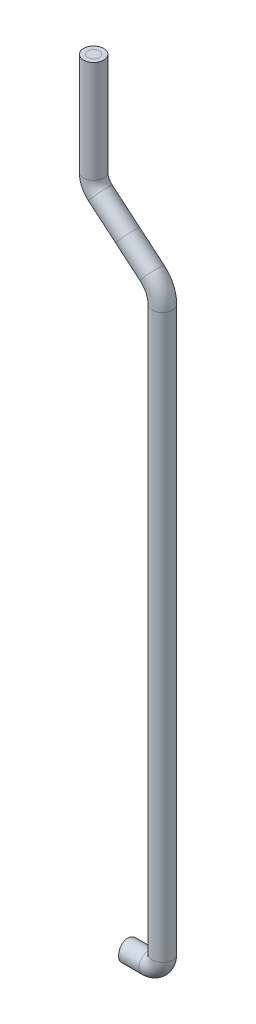
from build123d import *

# Parameters (mm, degrees)
SKETCH_1_R          = 1.05
SKETCH_3_R          = 0.6
SKETCH_4_R          = 0.6
SKETCH_5_R          = 0.6
SKETCH_7_R          = 1.05
SKETCH_7_R_2        = 0.6
CUT_EXTRUDE_2_DEPTH = 3
CUT_EXTRUDE_3_DEPTH = 3


with BuildPart() as part:
    # Sweep 1: sweep along a path in Эскиз2
    with BuildLine(Plane.XY) as sweep_1_path:
        Line((0, 0), (0, 58.480318356))
        ThreePointArc((0, 58.480318356), (-0.281076639, 59.748173141), (-1.071637171, 60.778451685))
        Line((-1.071637171, 60.778451685), (-3.6, 62.900000002))
        Line((-3.6, 62.900000002), (-6.435575219, 65.279330123))
        ThreePointArc((-6.435575219, 65.279330123), (-6.962615574, 65.966182486), (-7.15, 66.811419009))
        Line((-7.15, 66.811419009), (-7.15, 77.419549689))
    # Эскиз1 → Sweep 1 (sweep)
    with BuildSketch(Plane(origin=(0, 0, 0), x_dir=(1, 0, 0), z_dir=(0, 1, 0))):
        Circle(SKETCH_1_R)
    sweep(path=sweep_1_path.line)

    # Sweep 1 2: sweep along a path in Эскиз2<2>
    with BuildLine(Plane.XY) as sweep_1_2_path:
        Line((0, 0), (0, 58.480318356))
        ThreePointArc((0, 58.480318356), (-0.281076639, 59.748173141), (-1.071637171, 60.778451685))
        Line((-1.071637171, 60.778451685), (-3.6, 62.900000002))
        Line((-3.6, 62.900000002), (-6.435575219, 65.279330123))
        ThreePointArc((-6.435575219, 65.279330123), (-6.962615574, 65.966182486), (-7.15, 66.811419009))
        Line((-7.15, 66.811419009), (-7.15, 77.419549689))
    # Эскиз3 → Sweep 1 2 (sweep, cut)
    with BuildSketch(Plane.XZ):
        Circle(SKETCH_3_R)
    sweep(path=sweep_1_2_path.line, mode=Mode.SUBTRACT)

    # По траектории4: sweep along a path in Эскиз6<2>
    with BuildLine(Plane.XY) as sweep_4_path:
        Line((-3.6, -1.4), (-1.4, -1.4))
        ThreePointArc((-1.4, -1.4), (-0.410050506, -0.989949494), (0, 0))
    # Эскиз7 → По траектории4 (sweep)
    with BuildSketch(Plane.XZ):
        Circle(SKETCH_7_R)
        Circle(SKETCH_7_R_2, mode=Mode.SUBTRACT)
    sweep(path=sweep_4_path.line)


with BuildPart() as body_2:
    # По траектории2: sweep along a path in Эскиз2<3>
    with BuildLine(Plane.XY) as sweep_2_path:
        Line((0, 0), (0, 58.480318356))
        ThreePointArc((0, 58.480318356), (-0.281076639, 59.748173141), (-1.071637171, 60.778451685))
        Line((-1.071637171, 60.778451685), (-3.6, 62.900000002))
        Line((-3.6, 62.900000002), (-6.435575219, 65.279330123))
        ThreePointArc((-6.435575219, 65.279330123), (-6.962615574, 65.966182486), (-7.15, 66.811419009))
        Line((-7.15, 66.811419009), (-7.15, 77.419549689))
    # Эскиз4 → По траектории2 (sweep)
    with BuildSketch(Plane.XZ):
        Circle(SKETCH_4_R)
    sweep(path=sweep_2_path.line)

    # По траектории3: sweep along a path in Эскиз6
    with BuildLine(Plane.XY) as sweep_3_path:
        Line((-3.6, -1.4), (-1.4, -1.4))
        ThreePointArc((-1.4, -1.4), (-0.410050506, -0.989949494), (0, 0))
    # Эскиз5 → По траектории3 (sweep)
    with BuildSketch(Plane.XZ):
        Circle(SKETCH_5_R)
    sweep(path=sweep_3_path.line)


with BuildPart() as cut_extrude_2_tool:
    # Эскиз8 → Вырез-Вытянуть2 (new body)
    with BuildSketch(Plane(origin=(0, -2.45, 0), x_dir=(-1, 0, 0), z_dir=(0, -1, 0))):
        with BuildLine():
            ThreePointArc((3.5074106, 1.05), (3.576807827, 0.52703719), (3.6, 0))
            Line((3.6, 0), (3.6, 1.05))
            Line((3.6, 1.05), (3.5074106, 1.05))
        make_face()
    extrude(amount=-CUT_EXTRUDE_2_DEPTH)


with BuildPart() as part_1:
    add(part.part)

    # Вырез-Вытянуть2: cut by cut_extrude_2_tool
    add(cut_extrude_2_tool.part, mode=Mode.SUBTRACT)


with BuildPart() as body_2_1:
    add(body_2.part)

    # Вырез-Вытянуть2: cut by cut_extrude_2_tool
    add(cut_extrude_2_tool.part, mode=Mode.SUBTRACT)


with BuildPart() as cut_extrude_3_tool:
    # Эскиз8<3> → Вырез-Вытянуть3 (new body)
    with BuildSketch(Plane(origin=(0, -2.45, 0), x_dir=(-1, 0, 0), z_dir=(0, -1, 0))):
        with BuildLine():
            Line((3.5074106, -1.05), (3.6, -1.05))
            Line((3.6, -1.05), (3.6, 0))
            ThreePointArc((3.6, 0), (3.576807827, -0.52703719), (3.5074106, -1.05))
        make_face()
    extrude(amount=-CUT_EXTRUDE_3_DEPTH)


with BuildPart() as part_2:
    add(part_1.part)

    # Вырез-Вытянуть3: cut by cut_extrude_3_tool
    add(cut_extrude_3_tool.part, mode=Mode.SUBTRACT)


with BuildPart() as body_2_2:
    add(body_2_1.part)

    # Вырез-Вытянуть3: cut by cut_extrude_3_tool
    add(cut_extrude_3_tool.part, mode=Mode.SUBTRACT)


solid = Compound([part_2.part, body_2_2.part])
